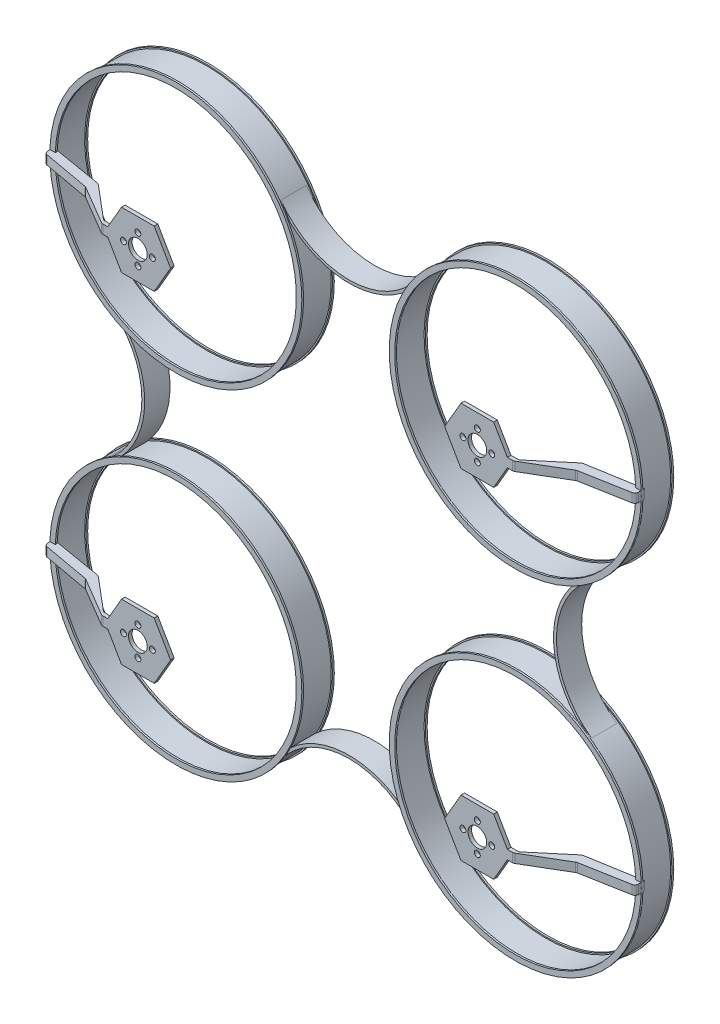
from build123d import *

# Parameters (mm, degrees)
F_1P6MM_START       = -44
SKETCH_14_R         = 69.1
SKETCH_14_R_2       = 67.5
F_1P6MM_DEPTH       = 18
F_1P6MM_2_DEPTH     = 18
F_1P6MM_3_DEPTH     = 18
F_1P6MM_4_DEPTH     = 18
EXTRUDE_START       = -42
EXTRUDE_0_DEPTH     = 14
EXTRUDE_1_DEPTH     = 14
EXTRUDE_2_DEPTH     = 14
EXTRUDE_3_DEPTH     = 14
F_1MM_START         = -44
SKETCH_19_R         = 69.8
SKETCH_19_R_2       = 66.8
F_1MM_DEPTH         = 1
F_1MM_START_2       = -27
F_1MM_2_OUTLINE_R   = 69.8
F_1MM_2_OUTLINE_R_2 = 66.8
F_1MM_2_DEPTH       = 1
EXTRUDE_START_2     = -7
SKETCH_21_R         = 5.2
SKETCH_21_R_2       = 1.65
EXTRUDE_1_1_DEPTH   = 2
EXTRUDE_START_3     = -96.5
EXTRUDE_1_1_2_DEPTH = 5
SKETCH_23_R         = 5.2
SKETCH_23_R_2       = 1.65
EXTRUDE_1_1_3_DEPTH = 2
EXTRUDE_START_4     = 91.5
EXTRUDE_1_1_4_DEPTH = 5
SKETCH_25_R         = 5.2
SKETCH_25_R_2       = 1.65
EXTRUDE_1_1_5_DEPTH = 2
EXTRUDE_1_1_6_DEPTH = 5
SKETCH_27_R         = 5.2
SKETCH_27_R_2       = 1.65
EXTRUDE_1_1_7_DEPTH = 2
EXTRUDE_1_1_8_DEPTH = 5
FILLET_R2_R         = 2


with BuildPart() as part:
    # 草图14 → 四个闭合护圈_1p6mm主壁 (new body)
    with BuildSketch(Plane.XY.offset(F_1P6MM_START)):
        with Locations((-94, -94)):
            Circle(SKETCH_14_R)
        with Locations((-94, -94)):
            Circle(SKETCH_14_R_2, mode=Mode.SUBTRACT)
    extrude(amount=F_1P6MM_DEPTH)



with BuildPart() as body_2:
    # 草图14 → 1p6mm 2 (new body)
    with BuildSketch(Plane.XY.offset(F_1P6MM_START)):
        with Locations((-94, 94)):
            Circle(SKETCH_14_R)
        with Locations((-94, 94)):
            Circle(SKETCH_14_R_2, mode=Mode.SUBTRACT)
    extrude(amount=F_1P6MM_2_DEPTH)


with BuildPart() as body_3:
    # 草图14 → 1p6mm 3 (new body)
    with BuildSketch(Plane.XY.offset(F_1P6MM_START)):
        with Locations((94, -94)):
            Circle(SKETCH_14_R)
        with Locations((94, -94)):
            Circle(SKETCH_14_R_2, mode=Mode.SUBTRACT)
    extrude(amount=F_1P6MM_3_DEPTH)


with BuildPart() as body_4:
    # 草图14 → 1p6mm 4 (new body)
    with BuildSketch(Plane.XY.offset(F_1P6MM_START)):
        with Locations((94, 94)):
            Circle(SKETCH_14_R)
        with Locations((94, 94)):
            Circle(SKETCH_14_R_2, mode=Mode.SUBTRACT)
    extrude(amount=F_1P6MM_4_DEPTH)


with BuildPart() as part_1:
    add(part.part)

    add(body_3.part)  # 相邻桨圈内凹相切连接_0 merges body 3
    # 草图15 → 相邻桨圈内凹相切连接_0 (add)
    with BuildSketch(Plane.XY.offset(EXTRUDE_START)):
        with BuildLine():
            Line((39.121941393, -133.302018822), (37.821128151, -134.233622231))
            ThreePointArc((37.821128151, -134.233622231), (0, -114.8), (-37.821128151, -134.233622231))
            Line((-37.821128151, -134.233622231), (-39.121941393, -133.302018822))
            ThreePointArc((-39.121941393, -133.302018822), (0, -113.2), (39.121941393, -133.302018822))
        make_face()
    extrude(amount=EXTRUDE_0_DEPTH)


    add(body_4.part)  # 相邻桨圈内凹相切连接_1 merges body 4
    # 草图16 → 相邻桨圈内凹相切连接_1 (add)
    with BuildSketch(Plane.XY.offset(EXTRUDE_START)):
        with BuildLine():
            Line((133.302018822, 39.121941393), (134.233622231, 37.821128151))
            ThreePointArc((134.233622231, 37.821128151), (114.8, 0), (134.233622231, -37.821128151))
            Line((134.233622231, -37.821128151), (133.302018822, -39.121941393))
            ThreePointArc((133.302018822, -39.121941393), (113.2, 0), (133.302018822, 39.121941393))
        make_face()
    extrude(amount=EXTRUDE_1_DEPTH)


    add(body_2.part)  # 相邻桨圈内凹相切连接_2 merges body 2
    # 草图17 → 相邻桨圈内凹相切连接_2 (add)
    with BuildSketch(Plane.XY.offset(EXTRUDE_START)):
        with BuildLine():
            Line((-39.121941393, 133.302018822), (-37.821128151, 134.233622231))
            ThreePointArc((-37.821128151, 134.233622231), (0, 114.8), (37.821128151, 134.233622231))
            Line((37.821128151, 134.233622231), (39.121941393, 133.302018822))
            ThreePointArc((39.121941393, 133.302018822), (0, 113.2), (-39.121941393, 133.302018822))
        make_face()
    extrude(amount=EXTRUDE_2_DEPTH)

    # 草图18 → 相邻桨圈内凹相切连接_3 (add)
    with BuildSketch(Plane.XY.offset(EXTRUDE_START)):
        with BuildLine():
            Line((-133.302018822, -39.121941393), (-134.233622231, -37.821128151))
            ThreePointArc((-134.233622231, -37.821128151), (-114.8, 0), (-134.233622231, 37.821128151))
            Line((-134.233622231, 37.821128151), (-133.302018822, 39.121941393))
            ThreePointArc((-133.302018822, 39.121941393), (-113.2, 0), (-133.302018822, -39.121941393))
        make_face()
    extrude(amount=EXTRUDE_3_DEPTH)

    # 草图19 → 1mm (add)
    # profile 1 of 4: a face of its own
    with BuildSketch(Plane.XY.offset(F_1MM_START)):
        with Locations((-94, -94)):
            Circle(SKETCH_19_R)
        with Locations((-94, -94)):
            Circle(SKETCH_19_R_2, mode=Mode.SUBTRACT)
    # profile 2 of 4: a face of its own
    with BuildSketch(Plane.XY.offset(F_1MM_START)):
        with Locations((-94, 94)):
            Circle(SKETCH_19_R)
        with Locations((-94, 94)):
            Circle(SKETCH_19_R_2, mode=Mode.SUBTRACT)
    # profile 3 of 4: a face of its own
    with BuildSketch(Plane.XY.offset(F_1MM_START)):
        with Locations((94, -94)):
            Circle(SKETCH_19_R)
        with Locations((94, -94)):
            Circle(SKETCH_19_R_2, mode=Mode.SUBTRACT)
    # profile 4 of 4: a face of its own
    with BuildSketch(Plane.XY.offset(F_1MM_START)):
        with Locations((94, 94)):
            Circle(SKETCH_19_R)
        with Locations((94, 94)):
            Circle(SKETCH_19_R_2, mode=Mode.SUBTRACT)
    extrude(amount=F_1MM_DEPTH)

    # 1mm 2: read off the stored shape, not the designer's step
    # 1mm 2 outline → 1mm 2 (add)
    # profile 1 of 4: a face of its own
    with BuildSketch(Plane.XY.offset(F_1MM_START_2)):
        with Locations((-94, -94)):
            Circle(F_1MM_2_OUTLINE_R)
        with Locations((-94, -94)):
            Circle(F_1MM_2_OUTLINE_R_2, mode=Mode.SUBTRACT)
    # profile 2 of 4: a face of its own
    with BuildSketch(Plane.XY.offset(F_1MM_START_2)):
        with Locations((-94, 94)):
            Circle(F_1MM_2_OUTLINE_R)
        with Locations((-94, 94)):
            Circle(F_1MM_2_OUTLINE_R_2, mode=Mode.SUBTRACT)
    # profile 3 of 4: a face of its own
    with BuildSketch(Plane.XY.offset(F_1MM_START_2)):
        with Locations((94, -94)):
            Circle(F_1MM_2_OUTLINE_R)
        with Locations((94, -94)):
            Circle(F_1MM_2_OUTLINE_R_2, mode=Mode.SUBTRACT)
    # profile 4 of 4: a face of its own
    with BuildSketch(Plane.XY.offset(F_1MM_START_2)):
        with Locations((94, 94)):
            Circle(F_1MM_2_OUTLINE_R)
        with Locations((94, 94)):
            Circle(F_1MM_2_OUTLINE_R_2, mode=Mode.SUBTRACT)
    extrude(amount=F_1MM_2_DEPTH)



with BuildPart() as body_2_2:
    # 草图21 → Extrude 1_-1 (new body)
    with BuildSketch(Plane.XY.offset(EXTRUDE_START_2)):
        Polygon((-75.9, -94), (-84.95, -78.324940192), (-103.05, -78.324940192), (-112.1, -94), (-103.05, -109.675059808), (-84.95, -109.675059808), align=None)
        with Locations((-94, -94)):
            Circle(SKETCH_21_R, mode=Mode.SUBTRACT)
        with Locations((-102, -94)):
            Circle(SKETCH_21_R_2, mode=Mode.SUBTRACT)
        with Locations((-94, -102)):
            Circle(SKETCH_21_R_2, mode=Mode.SUBTRACT)
        with Locations((-86, -94)):
            Circle(SKETCH_21_R_2, mode=Mode.SUBTRACT)
        with Locations((-94, -86)):
            Circle(SKETCH_21_R_2, mode=Mode.SUBTRACT)
    extrude(amount=EXTRUDE_1_1_DEPTH)


with BuildPart() as part_2:
    add(part_1.part)

    add(body_2_2.part)  # Extrude 1_-1 2 merges body 2 2
    # Extrude 1_-1 2: read off the stored shape, not the designer's step
    # Extrude 1_-1 2 outline → Extrude 1_-1 2 (add)
    with BuildSketch(Plane(origin=(0, 0, 0), x_dir=(1, 0, 0), z_dir=(0, 1, 0)).offset(EXTRUDE_START_3)):
        Polygon((-114, 5), (-104, 5), (-104, 7), (-115, 7), (-134, 23), (-163.6, 28), (-163.6, 23), (-136, 18), align=None)
    extrude(amount=EXTRUDE_1_1_2_DEPTH)



with BuildPart() as body_2_3:
    # 草图23 → 相邻桨圈内凹相切连接_1_1 3 (new body)
    with BuildSketch(Plane.XY.offset(EXTRUDE_START_2)):
        Polygon((-75.9, 94), (-84.95, 109.675059808), (-103.05, 109.675059808), (-112.1, 94), (-103.05, 78.324940192), (-84.95, 78.324940192), align=None)
        with Locations((-94, 94)):
            Circle(SKETCH_23_R, mode=Mode.SUBTRACT)
        with Locations((-102, 94)):
            Circle(SKETCH_23_R_2, mode=Mode.SUBTRACT)
        with Locations((-94, 86)):
            Circle(SKETCH_23_R_2, mode=Mode.SUBTRACT)
        with Locations((-86, 94)):
            Circle(SKETCH_23_R_2, mode=Mode.SUBTRACT)
        with Locations((-94, 102)):
            Circle(SKETCH_23_R_2, mode=Mode.SUBTRACT)
    extrude(amount=EXTRUDE_1_1_3_DEPTH)


with BuildPart() as part_3:
    add(part_2.part)

    add(body_2_3.part)  # 相邻桨圈内凹相切连接_1_1 4 merges body 2 3
    # 草图24 → 相邻桨圈内凹相切连接_1_1 4 (add)
    with BuildSketch(Plane(origin=(0, 0, 0), x_dir=(1, 0, 0), z_dir=(0, 1, 0)).offset(EXTRUDE_START_4)):
        Polygon((-104, 5), (-114, 5), (-136, 18), (-163.6, 23), (-163.6, 28), (-134, 23), (-115, 7), (-104, 7), align=None)
    extrude(amount=EXTRUDE_1_1_4_DEPTH)



with BuildPart() as body_2_4:
    # 草图25 → Extrude 1_-1 5 (new body)
    with BuildSketch(Plane.XY.offset(EXTRUDE_START_2)):
        Polygon((112.1, -94), (103.05, -78.324940192), (84.95, -78.324940192), (75.9, -94), (84.95, -109.675059808), (103.05, -109.675059808), align=None)
        with Locations((94, -94)):
            Circle(SKETCH_25_R, mode=Mode.SUBTRACT)
        with Locations((86, -94)):
            Circle(SKETCH_25_R_2, mode=Mode.SUBTRACT)
        with Locations((94, -102)):
            Circle(SKETCH_25_R_2, mode=Mode.SUBTRACT)
        with Locations((102, -94)):
            Circle(SKETCH_25_R_2, mode=Mode.SUBTRACT)
        with Locations((94, -86)):
            Circle(SKETCH_25_R_2, mode=Mode.SUBTRACT)
    extrude(amount=EXTRUDE_1_1_5_DEPTH)


with BuildPart() as part_4:
    add(part_3.part)

    add(body_2_4.part)  # Extrude 1_-1 6 merges body 2 4
    # Extrude 1_-1 6: read off the stored shape, not the designer's step
    # Extrude 1_-1 6 outline → Extrude 1_-1 6 (add)
    with BuildSketch(Plane(origin=(0, 0, 0), x_dir=(1, 0, 0), z_dir=(0, 1, 0)).offset(EXTRUDE_START_3)):
        Polygon((104, 7), (104, 5), (114, 5), (136, 18), (163.6, 23), (163.6, 28), (134, 23), (115, 7), align=None)
    extrude(amount=EXTRUDE_1_1_6_DEPTH)



with BuildPart() as body_2_5:
    # 草图27 → 相邻桨圈内凹相切连接_1_1 7 (new body)
    with BuildSketch(Plane.XY.offset(EXTRUDE_START_2)):
        Polygon((112.1, 94), (103.05, 109.675059808), (84.95, 109.675059808), (75.9, 94), (84.95, 78.324940192), (103.05, 78.324940192), align=None)
        with Locations((94, 94)):
            Circle(SKETCH_27_R, mode=Mode.SUBTRACT)
        with Locations((86, 94)):
            Circle(SKETCH_27_R_2, mode=Mode.SUBTRACT)
        with Locations((94, 86)):
            Circle(SKETCH_27_R_2, mode=Mode.SUBTRACT)
        with Locations((102, 94)):
            Circle(SKETCH_27_R_2, mode=Mode.SUBTRACT)
        with Locations((94, 102)):
            Circle(SKETCH_27_R_2, mode=Mode.SUBTRACT)
    extrude(amount=EXTRUDE_1_1_7_DEPTH)


with BuildPart() as part_5:
    add(part_4.part)

    add(body_2_5.part)  # 相邻桨圈内凹相切连接_1_1 8 merges body 2 5
    # 草图28 → 相邻桨圈内凹相切连接_1_1 8 (add)
    with BuildSketch(Plane(origin=(0, 0, 0), x_dir=(1, 0, 0), z_dir=(0, 1, 0)).offset(EXTRUDE_START_4)):
        Polygon((104, 5), (114, 5), (136, 18), (163.6, 23), (163.6, 28), (134, 23), (115, 7), (104, 7), align=None)
    extrude(amount=EXTRUDE_1_1_8_DEPTH)

    # 外撑连续圆角_R2
    fillet_r2_edges = [part_5.edges().sort_by_distance(p)[0] for p in [
        (-134, -94, -23),
        (-115, -94, -7),
        (-163.6, -94, -23),
        (-136, -94, -18),
        (-114, -94, -5),
        (-134, 94, -23),
        (-115, 94, -7),
        (-163.6, 94, -23),
        (-136, 94, -18),
        (-114, 94, -5),
        (114, -94, -5),
        (136, -94, -18),
        (163.6, -94, -23),
        (134, -94, -23),
        (115, -94, -7),
        (114, 94, -5),
        (136, 94, -18),
        (163.6, 94, -23),
        (134, 94, -23),
        (115, 94, -7),
    ]]
    fillet(fillet_r2_edges, radius=FILLET_R2_R)


solid = part_5.part
